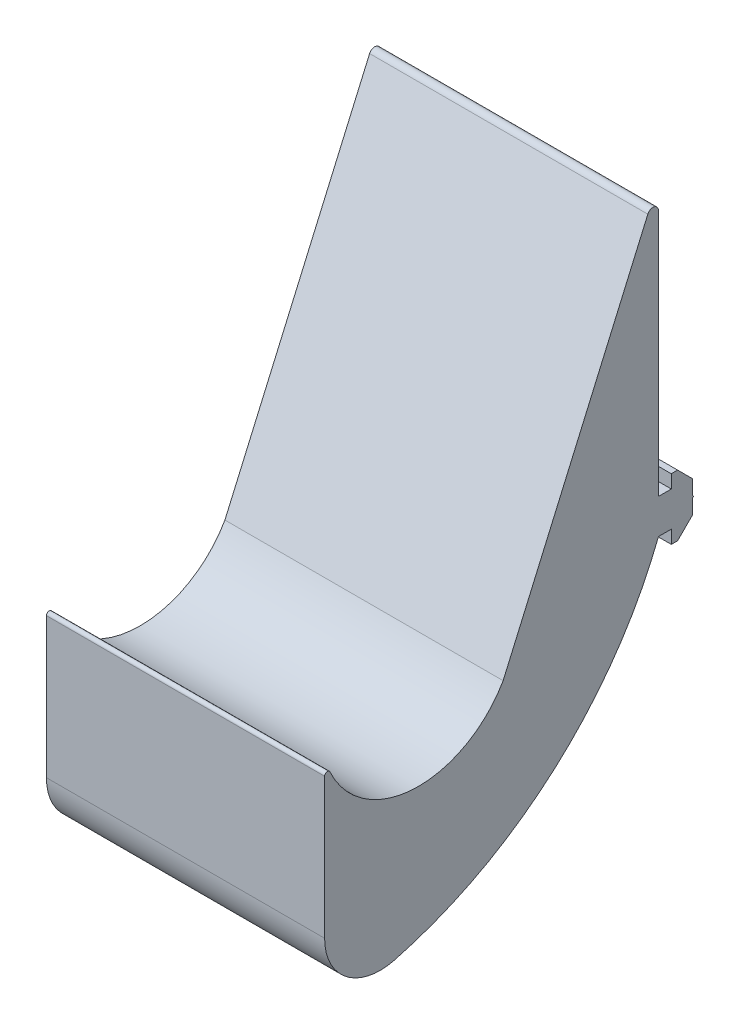
from build123d import *

# Parameters (mm, degrees)
BOSS_EXTRUDE1_DEPTH = 50
FILLET1_R           = 1
FILLET2_R           = 0.5
BOSS_EXTRUDE2_DEPTH = 50
FILLET3_R           = 70
FILLET4_R           = 10


with BuildPart() as part:
    # Sketch1 → Boss-Extrude1 (new body)
    with BuildSketch(Plane(origin=(0, 0, 0), x_dir=(0, 0, -1), z_dir=(1, 0, 0))):
        with BuildLine():
            Line((-30, -50), (30, -50))
            Line((30, -50), (30, 50))
            Line((30, 50), (2.079852522, -13.995823026))
            ThreePointArc((2.079852522, -13.995823026), (-15.294169853, -22.708497617), (-30, -10))
            Line((-30, -10), (-30, -50))
        make_face()
    extrude(amount=BOSS_EXTRUDE1_DEPTH)

    # Fillet1
    fillet1_edges = [part.edges().sort_by_distance(p)[0] for p in [
        (25, 50, -30),
    ]]
    fillet(fillet1_edges, radius=FILLET1_R)

    # Fillet2
    fillet2_edges = [part.edges().sort_by_distance(p)[0] for p in [
        (25, -10, 30),
    ]]
    fillet(fillet2_edges, radius=FILLET2_R)

    # Sketch2 → Boss-Extrude2 (add)
    with BuildSketch(Plane(origin=(50, 0, 0), x_dir=(0, 0, -1), z_dir=(1, 0, 0))):
        Polygon((31.455, 0.728575996), (30, 0.728575996), (30, -5.521424004), (31.455, -5.521424004), (31.8, -5.521424004), (32.3, -5.521424004), (32.3, -7.896424004), (33.439339828, -7.896424004), (36.1, -5.235763833), (36.1, -2.606424004), (36.31, -2.396424004), (36.1, -2.186424004), (36.1, 0.442915824), (33.439339828, 3.103575996), (32.3, 3.103575996), (32.3, 0.728575996), (31.8, 0.728575996), align=None)
    extrude(amount=-BOSS_EXTRUDE2_DEPTH)

    # Fillet3
    # the kernel refuses this fillet: 70 mm, written as the material it takes off along each edge
    with BuildSketch(Plane(origin=(-162.95430565, -50, -30), x_dir=(0, 0, 1), z_dir=(1, 0, 0))) as fillet3_piece_1:
        with BuildLine():
            CenterArc((65.18172226, -70), FILLET3_R, 90, 68.617538212)
            Line((0, -44.478575996), (0, 0))
            Line((0, 0), (65.18172226, 0))
        make_face()
    extrude(amount=375.9086113, mode=Mode.SUBTRACT)

    # Fillet4
    fillet4_edges = [part.edges().sort_by_distance(p)[0] for p in [
        (25, -49.807949078, 30),
    ]]
    fillet(fillet4_edges, radius=FILLET4_R)


solid = part.part
